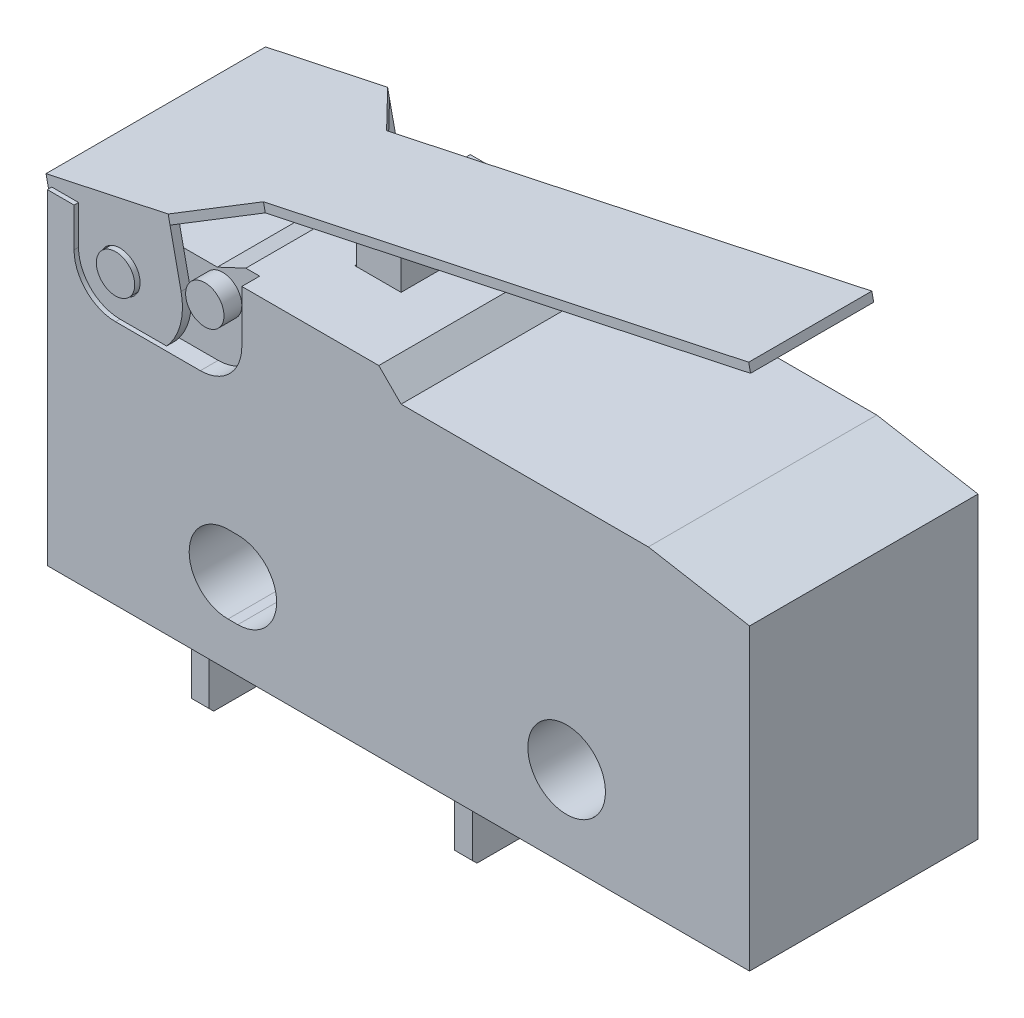
from build123d import *

# Parameters (mm, degrees)
SKETCH2_R          = 1.1049
EXTRUDE1_DEPTH     = 3.2512
EXTRUDE2_DEPTH     = 1.1049
SKETCH4_W          = 1.3208
SKETCH4_H          = 2.2606
CUT_EXTRUDE1_DEPTH = 1.016
SKETCH5_R          = 0.5461
CUT_EXTRUDE2_DEPTH = 0.508
SKETCH10_R         = 0.9017
EXTRUDE6_DEPTH     = 0.254
LPATTERN1_COUNT    = 2
LPATTERN1_PITCH    = 7.493
EXTRUDE3_DEPTH     = 1.7526
EXTRUDE4_START     = -0.127
SKETCH8_R          = 0.5715
EXTRUDE4_DEPTH     = 0.254
EXTRUDE5_DEPTH     = 1.1176


with BuildPart() as part:
    # Sketch2 → Extrude1 (new, symmetric)
    with BuildSketch(Plane.XY):
        Polygon((9.9949, 8.509), (7.113888836, 9.017), (0.0762, 9.017), (-0.5588, 9.652), (-4.8514, 9.652), (-5.664596778, 9.271), (-9.9949, 9.271), (-9.9949, 0), (9.9949, 0), align=None)
        with Locations((4.7879, 2.3622)):
            Circle(SKETCH2_R, mode=Mode.SUBTRACT)
        with BuildLine():
            Line((-4.8514, 3.4671), (-4.572, 3.4671))
            ThreePointArc((-4.572, 3.4671), (-3.4671, 2.3622), (-4.572, 1.2573))
            Line((-4.572, 1.2573), (-4.8514, 1.2573))
            ThreePointArc((-4.8514, 1.2573), (-5.9563, 2.3622), (-4.8514, 3.4671))
        make_face(mode=Mode.SUBTRACT)
    extrude(amount=EXTRUDE1_DEPTH, both=True)

    # Sketch4 → Cut-Extrude1 (cut)
    with BuildSketch(Plane(origin=(0, 9.652, 0), x_dir=(-1, 0, 0), z_dir=(0, 1, 0))):
        with Locations((2.7051, 0)):
            Rectangle(SKETCH4_W, SKETCH4_H)
    extrude(amount=-CUT_EXTRUDE1_DEPTH, mode=Mode.SUBTRACT)

    # Sketch5 → Cut-Extrude2 (cut)
    with BuildSketch(Plane.XY.offset(3.2512)):
        with BuildLine():
            Line((-9.2329, 9.271), (-9.2329, 8.1661))
            ThreePointArc((-9.2329, 8.1661), (-8.886963819, 7.330936181), (-8.0518, 6.985))
            Line((-8.0518, 6.985), (-5.6388, 6.985))
            ThreePointArc((-5.6388, 6.985), (-4.803636181, 7.330936181), (-4.4577, 8.1661))
            Line((-4.4577, 8.1661), (-4.4577, 9.652))
            Line((-4.4577, 9.652), (-4.8514, 9.652))
            Line((-4.8514, 9.652), (-5.664596778, 9.271))
            Line((-5.664596778, 9.271), (-9.2329, 9.271))
        make_face()
        with Locations((-5.5118, 8.6741)):
            Circle(SKETCH5_R, mode=Mode.SUBTRACT)
        with Locations((-8.0518, 8.1661)):
            Circle(SKETCH5_R, mode=Mode.SUBTRACT)
    cut_extrude2 = extrude(amount=-CUT_EXTRUDE2_DEPTH, mode=Mode.SUBTRACT)

    # Mirror1: Cut-Extrude2 across plane
    add(cut_extrude2.mirror(Plane.XY), mode=Mode.SUBTRACT)

    # Sketch10 → Extrude6 (add, symmetric)
    with BuildSketch(Plane(origin=(-7.493, 0, 0), x_dir=(0, 0, -1), z_dir=(1, 0, 0))):
        Polygon((-1.397, 0), (-1.397, -3.0734), (-1.27, -3.2004), (1.27, -3.2004), (1.397, -3.0734), (1.397, 0), align=None)
        with Locations((0, -1.7018)):
            Circle(SKETCH10_R, mode=Mode.SUBTRACT)
    extrude6 = extrude(amount=EXTRUDE6_DEPTH, both=True)

    # LPattern1: Extrude6 ×2
    with Locations(*[(i * LPATTERN1_PITCH, 0, 0) for i in range(1, LPATTERN1_COUNT)]):
        add(extrude6)


with BuildPart() as body_2:
    # Sketch3 → Extrude2 (new, symmetric)
    with BuildSketch(Plane.XY):
        with BuildLine():
            Line((-3.3401, 9.271), (-3.3401, 10.639314746))
            ThreePointArc((-3.3401, 10.639314746), (-2.7051, 10.8622), (-2.0701, 10.639314746))
            Line((-2.0701, 10.639314746), (-2.0701, 9.271))
            Line((-2.0701, 9.271), (-3.3401, 9.271))
        make_face()
    extrude(amount=EXTRUDE2_DEPTH, both=True)


with BuildPart() as body_3:
    # Sketch6 → Extrude3 (new, symmetric)
    with BuildSketch(Plane.XY):
        Polygon((-10.105498332, 9.271), (8.52397476, 13.251607025), (8.4709, 13.5), (-10.158573093, 9.519392975), align=None)
    extrude(amount=EXTRUDE3_DEPTH, both=True)


with BuildPart() as body_4:
    # Sketch8 → Extrude4 (new body)
    with BuildSketch(Plane.XY.offset(3.2512).offset(EXTRUDE4_START)):
        with BuildLine():
            Line((-6.313549941, 8.537516323), (-6.682072975, 10.262225621))
            Line((-6.682072975, 10.262225621), (-10.158573093, 9.519392975))
            Line((-10.158573093, 9.519392975), (-9.790050059, 7.794683677))
            ThreePointArc((-9.790050059, 7.794683677), (-7.680383677, 6.427849941), (-6.313549941, 8.537516323))
        make_face()
        with Locations((-8.0518, 8.1661)):
            Circle(SKETCH8_R, mode=Mode.SUBTRACT)
    extrude(amount=-EXTRUDE4_DEPTH)

    # Sketch9 → Extrude5 (add)
    with BuildSketch(Plane.XY.offset(1.7526)):
        Polygon((-6.628998215, 10.013832646), (-6.682072975, 10.262225621), (-10.158573093, 9.519392975), (-10.105498332, 9.271), align=None)
    extrude(amount=EXTRUDE5_DEPTH)


with BuildPart() as body_5:
    # Mirror7: mirrored copy
    add(body_4.part.mirror(Plane.XY))

    # Combine1: union body 3, body 4
    add(body_3.part)
    add(body_4.part)

    # Chamfer1
    # the kernel refuses this chamfer: 1.3716 mm, written as the material it adds along each edge
    with BuildSketch(Plane(origin=(-6.628998215, 10.013832646, -1.7526), x_dir=(-0.02688890779397689, -0.005745421501653921, -0.9996219169112968), z_dir=(-0.20895574936649164, 0.9779250967260673, 0))) as chamfer1_piece_1_section:
        with BuildLine():
            Line((1.410928155, 0), (-0.077560078, -1.408794766))
            Line((-0.077560078, -1.408794766), (-0.104981706, -1.408040499))
            ThreePointArc((-0.104981706, -1.408040499), (-0.046811648, -0.704176463), (-0.027421628, 0.000754267))
            Line((-0.027421628, 0.000754267), (0.000754267, 0.027421628))
            ThreePointArc((0.000754267, 0.027421628), (0.705684997, 0.008031609), (1.411682421, 0.027421628))
            Line((1.411682421, 0.027421628), (1.410928155, 0))
        make_face()
    chamfer1_piece_1 = extrude(amount=0.254, mode=Mode.PRIVATE)
    chamfer1_piece_1 = split(chamfer1_piece_1, bisect_by=Plane(origin=(-6.605283049, 10.148766723, -2.8702), z_dir=(0, 0, -1)), keep=Keep.TOP, mode=Mode.PRIVATE)
    chamfer1_piece_1 = split(chamfer1_piece_1, bisect_by=Plane(origin=(-6.605283049, 10.148766723, -3.1242), z_dir=(0, 0, 1)), keep=Keep.TOP, mode=Mode.PRIVATE)
    add(chamfer1_piece_1)
    with BuildSketch(Plane(origin=(-5.891944341, 6.564377516, -1.7526), x_dir=(-0.026888907793975552, -0.005745421501653636, -0.9996219169112968), z_dir=(-0.20895574936649164, 0.9779250967260673, 0))) as chamfer1_piece_2_section:
        with BuildLine():
            Line((1.410928155, 0), (-0.077560078, -1.408794766))
            Line((-0.077560078, -1.408794766), (-0.104981706, -1.408040499))
            ThreePointArc((-0.104981706, -1.408040499), (-0.046811648, -0.704176463), (-0.027421628, 0.000754267))
            Line((-0.027421628, 0.000754267), (0.000754267, 0.027421628))
            ThreePointArc((0.000754267, 0.027421628), (0.705684997, 0.008031609), (1.411682421, 0.027421628))
            Line((1.411682421, 0.027421628), (1.410928155, 0))
        make_face()
    chamfer1_piece_2 = extrude(amount=3.781320386, mode=Mode.PRIVATE)
    chamfer1_piece_2 = split(chamfer1_piece_2, bisect_by=Plane(origin=(-6.345522767, 8.530684608, -2.8702), z_dir=(0, 0, -1)), keep=Keep.TOP, mode=Mode.PRIVATE)
    chamfer1_piece_2 = split(chamfer1_piece_2, bisect_by=Plane(origin=(-6.345522767, 8.530684608, -3.1242), z_dir=(0, 0, 1)), keep=Keep.TOP, mode=Mode.PRIVATE)
    chamfer1_piece_2 = chamfer1_piece_2 & Plane(origin=(-8.0518, 8.1661, -3.007575957), x_dir=(-0.9779250967260683, -0.20895574936648695, 0), z_dir=(0, 0, -1)) * Cylinder(1.777487933, 14, mode=Mode.PRIVATE)
    add(chamfer1_piece_2)
    with BuildSketch(Plane(origin=(-6.628998215, 10.013832646, -1.7526), x_dir=(-0.02688890779397689, -0.005745421501653921, -0.9996219169112968), z_dir=(-0.20895574936649164, 0.9779250967260673, 0))) as chamfer1_piece_3_section:
        with BuildLine():
            Line((1.410928155, 0), (-0.077560078, -1.408794766))
            Line((-0.077560078, -1.408794766), (-0.104981706, -1.408040499))
            ThreePointArc((-0.104981706, -1.408040499), (-0.046811648, -0.704176463), (-0.027421628, 0.000754267))
            Line((-0.027421628, 0.000754267), (0.000754267, 0.027421628))
            ThreePointArc((0.000754267, 0.027421628), (0.705684997, 0.008031609), (1.411682421, 0.027421628))
            Line((1.411682421, 0.027421628), (1.410928155, 0))
        make_face()
    chamfer1_piece_3 = extrude(amount=0.254, mode=Mode.PRIVATE)
    chamfer1_piece_3 = split(chamfer1_piece_3, bisect_by=Plane(origin=(-6.194081793, 10.236629144, -2.8702), z_dir=(0, 0, 1)), keep=Keep.TOP, mode=Mode.PRIVATE)
    add(chamfer1_piece_3)
    with BuildSketch(Plane(origin=(-6.628998215, 10.013832646, 1.7526), x_dir=(-0.02688890779397689, -0.005745421501653921, 0.9996219169112968), z_dir=(-0.2089557493664916, 0.9779250967260672, 0))) as chamfer1_piece_4_section:
        with BuildLine():
            Line((1.410928155, 0), (-0.077560078, 1.408794766))
            Line((-0.077560078, 1.408794766), (-0.104981706, 1.408040499))
            ThreePointArc((-0.104981706, 1.408040499), (-0.046811648, 0.704176463), (-0.027421628, -0.000754267))
            Line((-0.027421628, -0.000754267), (0.000754267, -0.027421628))
            ThreePointArc((0.000754267, -0.027421628), (0.705684997, -0.008031609), (1.411682421, -0.027421628))
            Line((1.411682421, -0.027421628), (1.410928155, 0))
        make_face()
    chamfer1_piece_4 = extrude(amount=0.254, mode=Mode.PRIVATE)
    chamfer1_piece_4 = split(chamfer1_piece_4, bisect_by=Plane(origin=(-6.605283049, 10.148766723, 2.8702), z_dir=(0, 0, 1)), keep=Keep.TOP, mode=Mode.PRIVATE)
    chamfer1_piece_4 = split(chamfer1_piece_4, bisect_by=Plane(origin=(-6.605283049, 10.148766723, 3.1242), z_dir=(0, 0, -1)), keep=Keep.TOP, mode=Mode.PRIVATE)
    add(chamfer1_piece_4)
    with BuildSketch(Plane(origin=(-5.891944341, 6.564377516, 1.7526), x_dir=(-0.026888907793975552, -0.005745421501653634, 0.9996219169112968), z_dir=(-0.2089557493664916, 0.9779250967260672, 0))) as chamfer1_piece_5_section:
        with BuildLine():
            Line((1.410928155, 0), (-0.077560078, 1.408794766))
            Line((-0.077560078, 1.408794766), (-0.104981706, 1.408040499))
            ThreePointArc((-0.104981706, 1.408040499), (-0.046811648, 0.704176463), (-0.027421628, -0.000754267))
            Line((-0.027421628, -0.000754267), (0.000754267, -0.027421628))
            ThreePointArc((0.000754267, -0.027421628), (0.705684997, -0.008031609), (1.411682421, -0.027421628))
            Line((1.411682421, -0.027421628), (1.410928155, 0))
        make_face()
    chamfer1_piece_5 = extrude(amount=3.781320386, mode=Mode.PRIVATE)
    chamfer1_piece_5 = split(chamfer1_piece_5, bisect_by=Plane(origin=(-6.345522767, 8.530684608, 2.8702), z_dir=(0, 0, 1)), keep=Keep.TOP, mode=Mode.PRIVATE)
    chamfer1_piece_5 = chamfer1_piece_5 & Plane(origin=(-8.0518, 8.1661, 3.007575957), x_dir=(-0.9779250967260683, -0.20895574936648695, 0), z_dir=(0, 0, 1)) * Cylinder(1.777487933, 14, mode=Mode.PRIVATE)
    chamfer1_piece_5 = split(chamfer1_piece_5, bisect_by=Plane(origin=(-6.345522767, 8.530684608, 3.1242), z_dir=(0, 0, -1)), keep=Keep.TOP, mode=Mode.PRIVATE)
    add(chamfer1_piece_5)
    with BuildSketch(Plane(origin=(-6.628998215, 10.013832646, 1.7526), x_dir=(-0.02688890779397689, -0.005745421501653921, 0.9996219169112968), z_dir=(-0.2089557493664916, 0.9779250967260672, 0))) as chamfer1_piece_6_section:
        with BuildLine():
            Line((1.410928155, 0), (-0.077560078, 1.408794766))
            Line((-0.077560078, 1.408794766), (-0.104981706, 1.408040499))
            ThreePointArc((-0.104981706, 1.408040499), (-0.046811648, 0.704176463), (-0.027421628, -0.000754267))
            Line((-0.027421628, -0.000754267), (0.000754267, -0.027421628))
            ThreePointArc((0.000754267, -0.027421628), (0.705684997, -0.008031609), (1.411682421, -0.027421628))
            Line((1.411682421, -0.027421628), (1.410928155, 0))
        make_face()
    chamfer1_piece_6 = extrude(amount=0.254, mode=Mode.PRIVATE)
    chamfer1_piece_6 = split(chamfer1_piece_6, bisect_by=Plane(origin=(-6.194081793, 10.236629144, 2.8702), z_dir=(0, 0, -1)), keep=Keep.TOP, mode=Mode.PRIVATE)
    add(chamfer1_piece_6)


solid = Compound([part.part, body_2.part, body_5.part])
